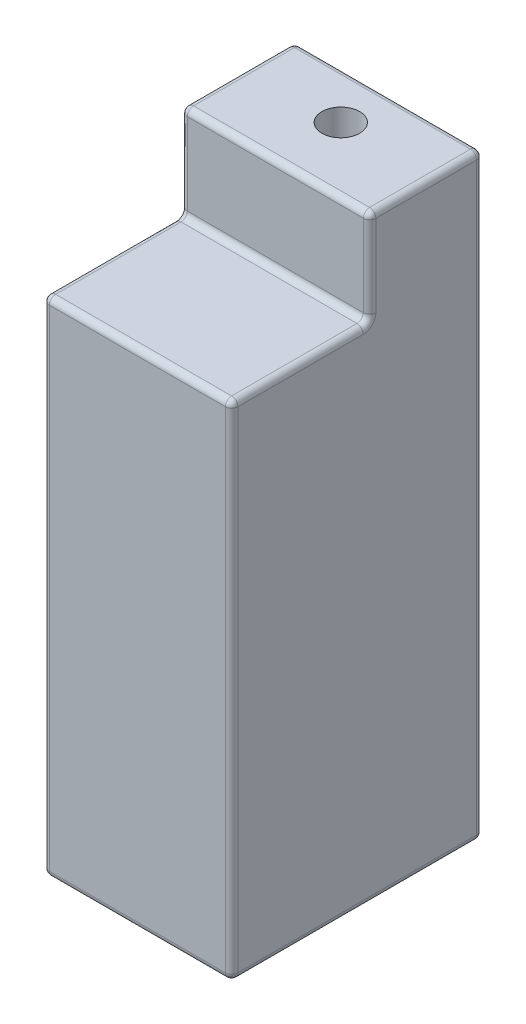
from build123d import *

# Parameters (mm, degrees)
SKETCH1_W           = 300
SKETCH1_H           = 800
BOSS_EXTRUDE1_DEPTH = 400
SKETCH3_W           = 300
SKETCH3_H           = 180.426730866
BOSS_EXTRUDE4_DEPTH = 150
FILLET6_R           = 10
SKETCH4_R           = 30
CUT_EXTRUDE1_DEPTH  = 150
SKETCH7_W           = 251.42002043
SKETCH7_H           = 445.81306925
CUT_EXTRUDE5_DEPTH  = 170
SKETCH8_R           = 40
CUT_EXTRUDE6_DEPTH  = 80
FILLET8_R           = 10


with BuildPart() as part:
    # Sketch1 → Boss-Extrude1 (new body)
    with BuildSketch(Plane.XY):
        Rectangle(SKETCH1_W, SKETCH1_H)
    extrude(amount=BOSS_EXTRUDE1_DEPTH)

    # Sketch3 → Boss-Extrude4 (add)
    with BuildSketch(Plane(origin=(0, 400, 0), x_dir=(1, 0, 0), z_dir=(0, 1, 0))):
        with Locations((0, -90.213365433)):
            Rectangle(SKETCH3_W, SKETCH3_H)
    extrude(amount=BOSS_EXTRUDE4_DEPTH)

    # Fillet6
    fillet6_edges = [part.edges().sort_by_distance(p)[0] for p in [
        (0, 550, 0),
        (0, -400, 0),
        (150, -400, 200),
        (150, 550, 90.213365433),
        (150, 75, 0),
        (150, 400, 290.213365433),
        (0, 550, 180.426730866),
        (150, 475, 180.426730866),
        (0, 400, 180.426730866),
        (0, -400, 400),
        (0, 400, 400),
        (150, 0, 400),
        (-150, 550, 90.213365433),
        (-150, 475, 180.426730866),
        (-150, 400, 290.213365433),
        (-150, 0, 400),
        (-150, -400, 200),
        (-150, 75, 0),
    ]]
    fillet(fillet6_edges, radius=FILLET6_R)

    # Sketch4 → Cut-Extrude1 (cut)
    with BuildSketch(Plane(origin=(0, 550, 0), x_dir=(1, 0, 0), z_dir=(0, 1, 0))):
        with Locations((0, -76.219748714)):
            Circle(SKETCH4_R)
    extrude(amount=-CUT_EXTRUDE1_DEPTH, mode=Mode.SUBTRACT)

    # Sketch7 → Cut-Extrude5 (cut)
    with BuildSketch(Plane(origin=(0, 0, 0), x_dir=(-1, 0, 0), z_dir=(0, 0, -1))):
        Rectangle(SKETCH7_W, SKETCH7_H)
    extrude(amount=-CUT_EXTRUDE5_DEPTH, mode=Mode.SUBTRACT)

    # Sketch8 → Cut-Extrude6 (cut)
    with BuildSketch(Plane.XZ.offset(400)):
        with Locations((0, 200)):
            Circle(SKETCH8_R)
    extrude(amount=-CUT_EXTRUDE6_DEPTH, mode=Mode.SUBTRACT)

    # Fillet8
    fillet8_edges = [part.edges().sort_by_distance(p)[0] for p in [
        (125.710010215, 0, 0),
        (0, -222.906534625, 0),
        (-125.710010215, 0, 0),
        (0, 222.906534625, 0),
    ]]
    fillet(fillet8_edges, radius=FILLET8_R)


solid = part.part
